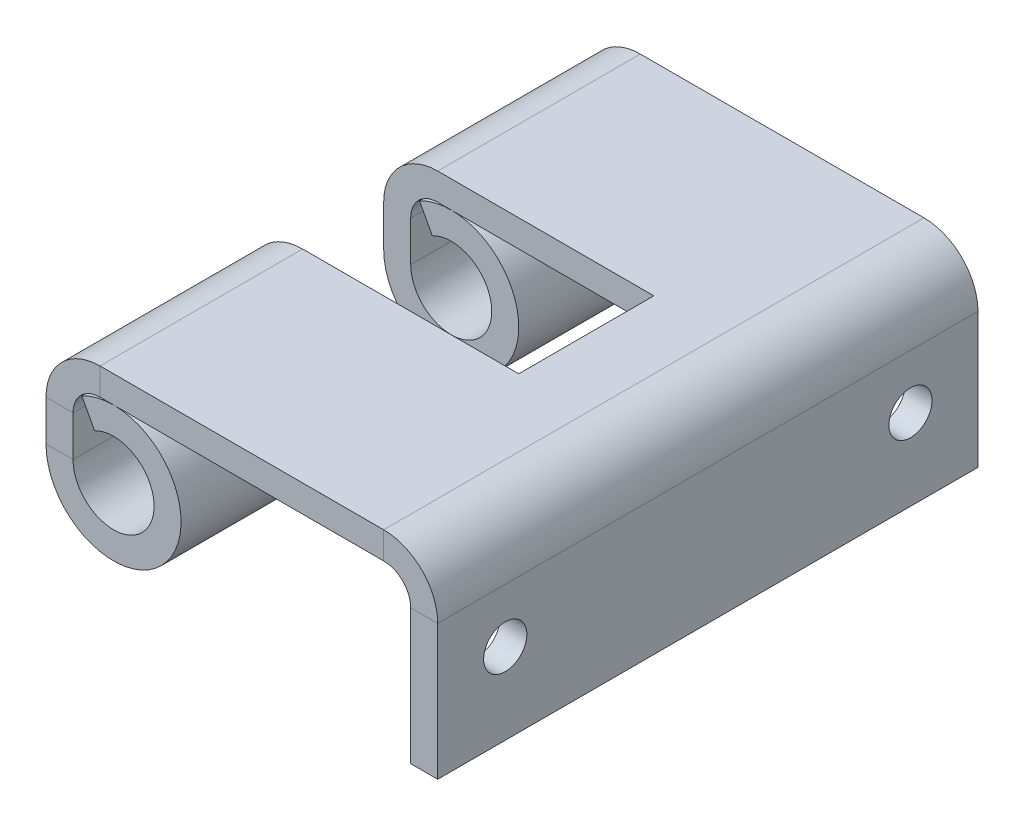
from build123d import *

# Parameters (mm, degrees)
BASE_FLANGE1_DEPTH        = 20
HEM1_DEPTH                = 20
HEM1_2_DEPTH              = 20
SKETCH5_W                 = 8
SKETCH5_H                 = 5
SKETCH5_W_2               = 2
CUT_EXTRUDE4_DEPTH        = 10
M2X0_4_TAPPED_HOLE1_D     = 1.6
M2X0_4_TAPPED_HOLE1_DEPTH = 5.2
M2X0_4_TAPPED_HOLE1_TIP   = 0.480688495


# Read off the part's stored shape, not the designer's step: Hem1
# Sheet-metal steps are written as plain solids
with BuildPart() as part:
    # Sketch1 → Base-Flange1 (new body)
    with BuildSketch(Plane.XY):
        with BuildLine():
            Line((0, 0), (0, 5))
            ThreePointArc((0, 5), (-0.585786438, 6.414213562), (-2, 7))
            Line((-2, 7), (-12.5, 7))
            ThreePointArc((-12.5, 7), (-13.914213562, 6.414213562), (-14.5, 5))
            Line((-14.5, 5), (-14.5, 1))
            Line((-14.5, 1), (-13.5, 1))
            Line((-13.5, 1), (-13.5, 5))
            ThreePointArc((-13.5, 5), (-13.207106781, 5.707106781), (-12.5, 6))
            Line((-12.5, 6), (-2, 6))
            ThreePointArc((-2, 6), (-1.292893219, 5.707106781), (-1, 5))
            Line((-1, 5), (-1, 0))
            Line((-1, 0), (0, 0))
        make_face()
    extrude(amount=BASE_FLANGE1_DEPTH)

    # Hem1 outline → Hem1 (cut)
    with BuildSketch(Plane.XY):
        with BuildLine():
            Line((-13.5, 1), (-13.5, 1.5))
            ThreePointArc((-13.5, 1.5), (-14.236067978, 2.381966011), (-14.5, 3.5))
            Line((-14.5, 3.5), (-14.5, 1))
            Line((-14.5, 1), (-13.5, 1))
        make_face()
    extrude(amount=HEM1_DEPTH, mode=Mode.SUBTRACT)

    # Hem1 2 outline → Hem1 2 (add)
    with BuildSketch(Plane.XY):
        with BuildLine():
            Line((-13.173678907, 5.707368982), (-12.704207344, 4.824421389))
            ThreePointArc((-12.704207344, 4.824421389), (-10.714249049, 2.727442887), (-13.5, 3.5))
            Line((-13.5, 3.5), (-13.5, 1.5))
            ThreePointArc((-13.5, 1.5), (-9.507485574, 3.30668203), (-13.173678907, 5.707368982))
        make_face()
    extrude(amount=HEM1_2_DEPTH)

    # Sketch5 → Cut-Extrude4 (cut)
    with BuildSketch(Plane(origin=(0, 7, 0), x_dir=(1, 0, 0), z_dir=(0, 1, 0))):
        with Locations((-8.5, -10)):
            Rectangle(SKETCH5_W, SKETCH5_H)
        with Locations((-13.5, -10)):
            Rectangle(SKETCH5_W_2, SKETCH5_H)
    extrude(amount=-CUT_EXTRUDE4_DEPTH, mode=Mode.SUBTRACT)

    # M2x0.4 Tapped Hole1
    with Locations(Plane.ZY.offset(1)):
        with Locations((2.5, 3), (17.5, 3)):
            Hole(M2X0_4_TAPPED_HOLE1_D / 2, depth=M2X0_4_TAPPED_HOLE1_DEPTH)
            with Locations((0, 0, -(M2X0_4_TAPPED_HOLE1_DEPTH + M2X0_4_TAPPED_HOLE1_TIP / 2))):  # 118° drill point
                Cone(0, M2X0_4_TAPPED_HOLE1_D / 2, M2X0_4_TAPPED_HOLE1_TIP, mode=Mode.SUBTRACT)


solid = part.part
